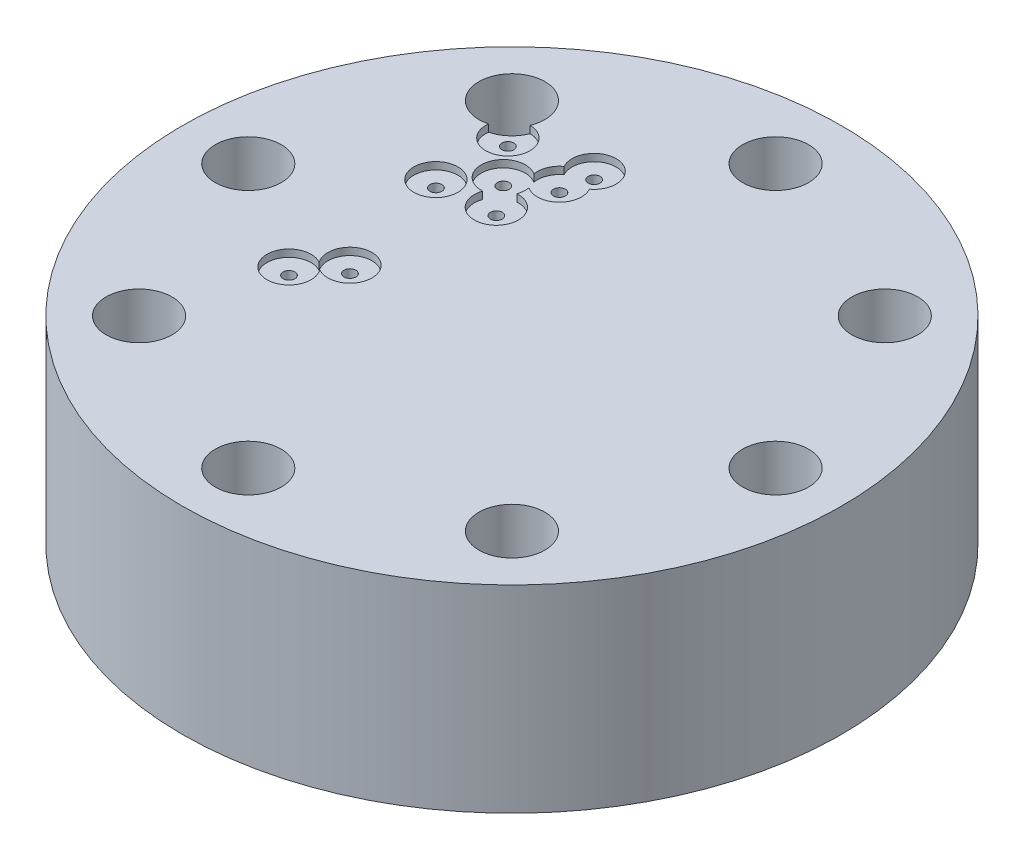
from build123d import *

# Parameters (mm, degrees)
SKETCH1_R           = 50
BOSS_EXTRUDE1_DEPTH = 30
CIRPATTERN1_COUNT   = 8


# Read off the part's stored shape, not the designer's step: Sketch-Pattern1
with BuildPart() as part:
    # Sketch1 → Boss-Extrude1 (new body)
    with BuildSketch(Plane(origin=(0, 0, 0), x_dir=(1, 0, 0), z_dir=(0, 1, 0))):
        with Locations(Location((0, 0, 0), (0, 0, 270))):
            Circle(SKETCH1_R)
    extrude(amount=BOSS_EXTRUDE1_DEPTH)

    # Sketch5 → CBORE for M5 Hex Head Cap Screw1 (revolve, cut)
    with BuildSketch(Plane(origin=(0, 30, -40), x_dir=(0, 0, 1), z_dir=(1, 0, 0))):
        Polygon((0, 0), (0, 20), (2.5, 18.497848452), (2.5, 10), (5, 10), (5, 0), align=None)
    cbore_for_m5_hex_head_cap_screw1 = revolve(axis=Axis((0, 36.35, -40), (0, -1, 0)), mode=Mode.SUBTRACT)

    # CirPattern1: CBORE for M5 Hex Head Cap Screw1 ×8 about axis
    cirpattern1_axis = Axis((0, 0, 0), (0, 1, 0))
    for i in range(1, CIRPATTERN1_COUNT):
        add(cbore_for_m5_hex_head_cap_screw1.rotate(cirpattern1_axis, i * 360 / CIRPATTERN1_COUNT), mode=Mode.SUBTRACT)

    # Sketch6 → Hole Wizard 950 (revolve, cut)
    with BuildSketch(Plane(origin=(-18.945239219, 30, 5.62940246), x_dir=(0, 0, 1), z_dir=(1, 0, 0))):
        Polygon((0, 0), (0, 20), (0.9, 19.459225443), (0.9, 1.1), (3.3475, 1.1), (3.3475, 0), align=None)
    hole_wizard_950 = revolve(axis=Axis((-18.945239219, 36.35, 5.62940246), (0, -1, 0)), mode=Mode.SUBTRACT)

    # Sketch-Pattern1 outline → Sketch-Pattern1 (revolve, cut)
    with BuildSketch(Plane(origin=(-23.333134216, 0, 10.487429063), x_dir=(1, 0, 0), z_dir=(0, 0, 1))):
        Polygon((3.3475, 30), (0, 30), (0, 10), (0.9, 10.540774557), (0.9, 28.9), (3.3475, 28.9), align=None)
    revolve(axis=Axis((-23.333134216, 0, 10.487429063), (0, 1, 0)), mode=Mode.SUBTRACT)

    # Sketch-Pattern2: Hole Wizard 950 at 6 more places
    with Locations((0.112884, 0, -23.151681), (-4.729973, 0, -17.769404), (3.49498, 0, -18.713251), (5.247838, 0, -26.533698), (-4.729973, 0, -28.691063), (6.191685, 0, -30.848427)):
        add(hole_wizard_950, mode=Mode.SUBTRACT)


solid = part.part
